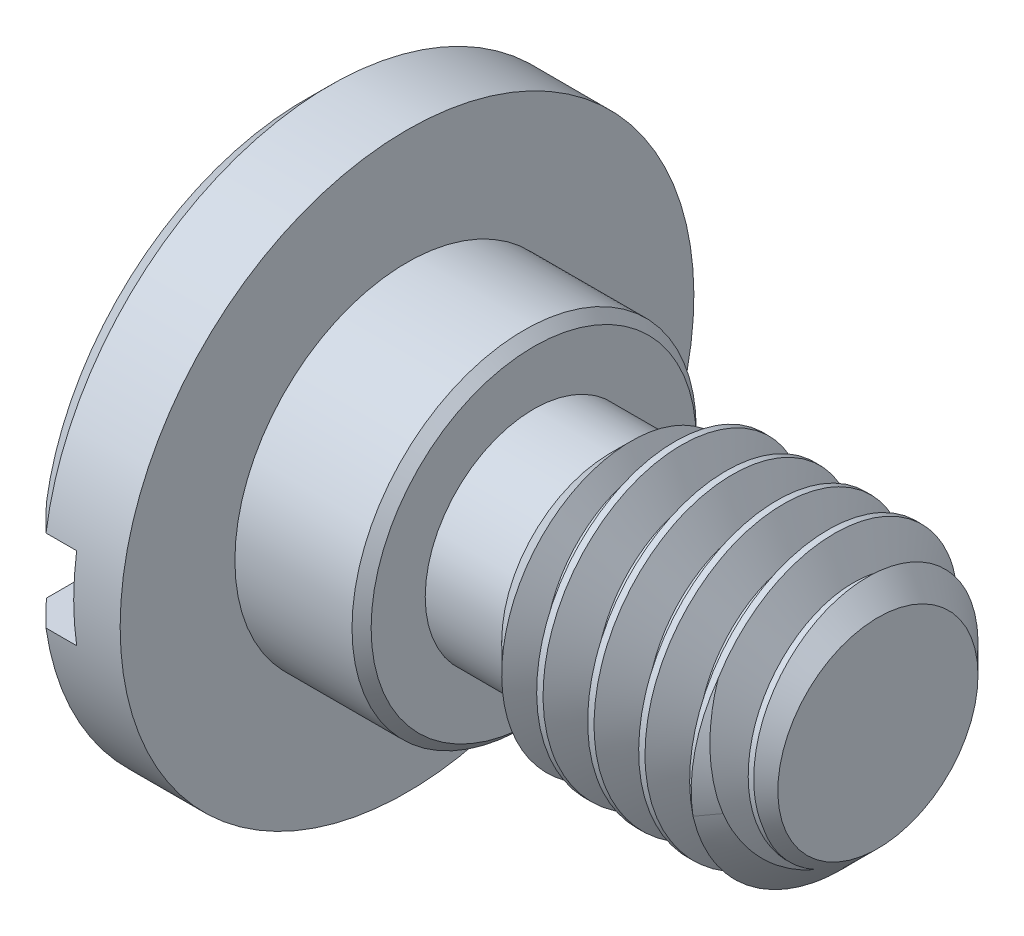
from build123d import *

# Parameters (mm, degrees)
SKETCH2_R               = 3.96875
EXTRUDE1_DEPTH          = 9.525
CHAMFER1_SIZE           = 1.199444444
CUT_SWEEP1_PITCH        = 1.411111111
SKETCH6_R               = 4.7625
EXTRUDE2_DEPTH          = 3.5052
SKETCH7_R               = 7.9375
EXTRUDE3_DEPTH          = 2.8448
CHAMFER2_SIZE           = 0.264583333
CHAMFER3_SIZE           = 0.7112
SKETCH8_W               = 15.875
SKETCH8_H               = 2.27584
CUT_EXTRUDE_THIN1_DEPTH = 1.559277778


with BuildPart() as part:
    # Sketch2 → Extrude1 (new body)
    with BuildSketch(Plane(origin=(7.9375, 0, 0), x_dir=(0, 0, -1), z_dir=(1, 0, 0))):
        Circle(SKETCH2_R)
    extrude(amount=-EXTRUDE1_DEPTH)

    # Chamfer1
    chamfer1_edges = [part.edges().sort_by_distance(p)[0] for p in [
        (7.9375, 0, 3.96875),
    ]]
    chamfer(chamfer1_edges, length=CHAMFER1_SIZE)

    # Cut-Sweep1: the profile of Sketch4 profile screwed along a right-hand helix of 7.3125 turns, 8 arcs to a turn; built about Z, then put on its axis
    cut_sweep1_z = Axis((0, 0, 0), (0, 0, 1))
    cut_sweep1_corners = [(3.96905, 0, -1.234895427), (3.96905, 0, 0.000173205), (3.052206448, 0, -0.529166667), (3.052206448, 0, -0.705555556)]
    with BuildLine(mode=Mode.PRIVATE) as cut_sweep1_profile:
        Line(cut_sweep1_corners[0], cut_sweep1_corners[1])
        Line(cut_sweep1_corners[1], cut_sweep1_corners[2])
        Line(cut_sweep1_corners[2], cut_sweep1_corners[3])
        Line(cut_sweep1_corners[3], cut_sweep1_corners[0])
    cut_sweep1_cap = Face(cut_sweep1_profile.wire())
    cut_sweep1_turn_angles = [0, 22.5, 45, 67.5, 90, 112.5, 135, 157.5, 180, 202.5, 225, 247.5, 270, 292.5, 315, 337.5, 360]
    cut_sweep1_turn_weights = [1, 0.9238795325112867, 1, 0.9238795325112867, 1, 0.9238795325112867, 1, 0.9238795325112867, 1, 0.9238795325112867, 1, 0.9238795325112867, 1, 0.9238795325112867, 1, 0.9238795325112867, 1]
    cut_sweep1_turn_rails = [Edge.make_bspline([Vector(p[0], p[1], 0).rotate(cut_sweep1_z, cut_sweep1_turn_angles[k]) / cut_sweep1_turn_weights[k] + Vector(0, 0, p[2] + CUT_SWEEP1_PITCH * cut_sweep1_turn_angles[k] / 360) for k in range(17)], [0, 0, 0, 1, 1, 2, 2, 3, 3, 4, 4, 5, 5, 6, 6, 7, 7, 8, 8, 8], 2, cut_sweep1_turn_weights) for p in cut_sweep1_corners]
    cut_sweep1_turn_sides = [Face.make_surface_from_curves(cut_sweep1_turn_rails[p[0]], cut_sweep1_turn_rails[p[1]]) for p in [(0, 1), (1, 2), (2, 3), (3, 0)]]
    cut_sweep1_last_angles = [2520, 2542.5, 2565, 2587.5, 2610, 2621.25, 2632.5]
    cut_sweep1_last_weights = [1, 0.9238795325112867, 1, 0.9238795325112867, 1, 0.9807852804032227, 1]
    cut_sweep1_last_rails = [Edge.make_bspline([Vector(p[0], p[1], 0).rotate(cut_sweep1_z, cut_sweep1_last_angles[k]) / cut_sweep1_last_weights[k] + Vector(0, 0, p[2] + CUT_SWEEP1_PITCH * cut_sweep1_last_angles[k] / 360) for k in range(7)], [0, 0, 0, 1, 1, 2, 2, 3, 3, 3], 2, cut_sweep1_last_weights) for p in cut_sweep1_corners]
    cut_sweep1_last_sides = [Face.make_surface_from_curves(cut_sweep1_last_rails[p[0]], cut_sweep1_last_rails[p[1]]) for p in [(0, 1), (1, 2), (2, 3), (3, 0)]]
    cut_sweep1 = Plane(origin=(7.9375, 0, 0), x_dir=(0, 1, 0), z_dir=(-1, 0, 0)) * Solid(Shell([*[p.moved(Location((0, 0, CUT_SWEEP1_PITCH * i))) for i in range(7) for p in cut_sweep1_turn_sides], *cut_sweep1_last_sides, cut_sweep1_cap, cut_sweep1_cap.rotate(cut_sweep1_z, 2632.5).moved(Location((0, 0, CUT_SWEEP1_PITCH * 2632.5 / 360)))]))
    add(cut_sweep1, mode=Mode.SUBTRACT)

    # Sketch5 → Cut-Revolve1 (revolve, cut)
    with BuildSketch(Plane.XY, mode=Mode.PRIVATE) as cut_revolve1_sk:
        Polygon((-1.5875, 3.96875), (-1.5875, 3.001406448), (0.529166667, 3.001406448), (1.496510219, 3.96875), align=None)
    revolve(cut_revolve1_sk.sketch.rotate(Axis((-7.9375, 0, 0), (1, 0, 0)), 99.225884585), axis=Axis((-7.9375, 0, 0), (1, 0, 0)), mode=Mode.SUBTRACT)

    # Sketch6 → Extrude2 (add)
    with BuildSketch(Plane.ZY.offset(1.5875)):
        Circle(SKETCH6_R)
    extrude(amount=EXTRUDE2_DEPTH)

    # Sketch7 → Extrude3 (add)
    with BuildSketch(Plane.ZY.offset(5.0927)):
        Circle(SKETCH7_R)
    extrude(amount=EXTRUDE3_DEPTH)

    # Chamfer2
    chamfer2_edges = [part.edges().sort_by_distance(p)[0] for p in [
        (-1.5875, 0, -4.7625),
    ]]
    chamfer(chamfer2_edges, length=CHAMFER2_SIZE)

    # Chamfer3
    chamfer3_edges = [part.edges().sort_by_distance(p)[0] for p in [
        (-7.9375, 0, -7.9375),
    ]]
    chamfer(chamfer3_edges, length=CHAMFER3_SIZE)

    # Sketch8 → Cut-Extrude-Thin1 (cut)
    with BuildSketch(Plane.ZY.offset(7.9375)):
        Rectangle(SKETCH8_W, SKETCH8_H)
    extrude(amount=-CUT_EXTRUDE_THIN1_DEPTH, mode=Mode.SUBTRACT)


solid = part.part
